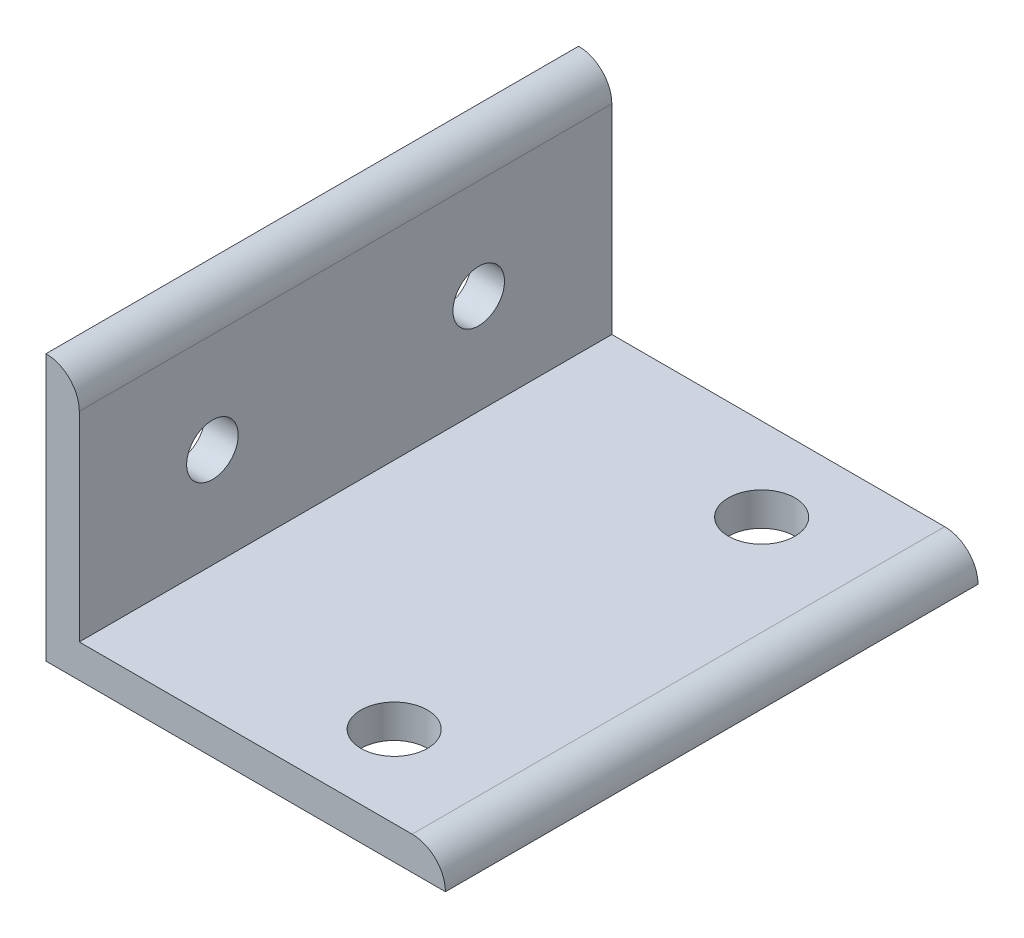
from build123d import *

# Parameters (mm, degrees)
BOSS_EXTRUDE1_DEPTH              = 25.4
F_1_4_0_25_DIAMETER_HOLE1_D      = 6.35
F_1_4_0_25_DIAMETER_HOLE1_DEPTH  = 17.526
F_1_4_0_25_DIAMETER_HOLE1_TIP    = 1.907732465
F_10_0_1935_DIAMETER_HOLE1_D     = 4.9149
F_10_0_1935_DIAMETER_HOLE1_DEPTH = 17.526
F_10_0_1935_DIAMETER_HOLE1_TIP   = 1.476584928
FILLET1_R                        = 3.175


with BuildPart() as part:
    # Sketch1 → Boss-Extrude1 (new, symmetric)
    with BuildSketch(Plane.XY):
        Polygon((-8.126488095, 19.768154762), (-8.126488095, -5.631845238), (29.973511905, -5.631845238), (29.973511905, -2.456845238), (-4.951488095, -2.456845238), (-4.951488095, 19.768154762), align=None)
    extrude(amount=BOSS_EXTRUDE1_DEPTH, both=True)

    # 1/4 (0.25) Diameter Hole1
    with Locations(Plane(origin=(0, -2.456845238, 0), x_dir=(1, 0, 0), z_dir=(0, 1, 0))):
        with Locations((17.273511905, 17.4625), (17.273511905, -17.5895)):
            Hole(F_1_4_0_25_DIAMETER_HOLE1_D / 2, depth=F_1_4_0_25_DIAMETER_HOLE1_DEPTH)
            with Locations((0, 0, -(F_1_4_0_25_DIAMETER_HOLE1_DEPTH + F_1_4_0_25_DIAMETER_HOLE1_TIP / 2))):  # 118° drill point
                Cone(0, F_1_4_0_25_DIAMETER_HOLE1_D / 2, F_1_4_0_25_DIAMETER_HOLE1_TIP, mode=Mode.SUBTRACT)

    # #10 (0.1935) Diameter Hole1
    with Locations(Plane(origin=(-4.951488095, 0, 0), x_dir=(0, 0, -1), z_dir=(1, 0, 0))):
        with Locations((12.7, 7.068154762), (-12.7, 7.068154762)):
            Hole(F_10_0_1935_DIAMETER_HOLE1_D / 2, depth=F_10_0_1935_DIAMETER_HOLE1_DEPTH)
            with Locations((0, 0, -(F_10_0_1935_DIAMETER_HOLE1_DEPTH + F_10_0_1935_DIAMETER_HOLE1_TIP / 2))):  # 118° drill point
                Cone(0, F_10_0_1935_DIAMETER_HOLE1_D / 2, F_10_0_1935_DIAMETER_HOLE1_TIP, mode=Mode.SUBTRACT)

    # Fillet1
    fillet1_edges = [part.edges().sort_by_distance(p)[0] for p in [
        (29.973511905, -2.456845238, 0),
        (-4.951488095, 19.768154762, 0),
    ]]
    fillet(fillet1_edges, radius=FILLET1_R - 0.0001)  # a hair under: the kernel refuses the full size


solid = part.part
